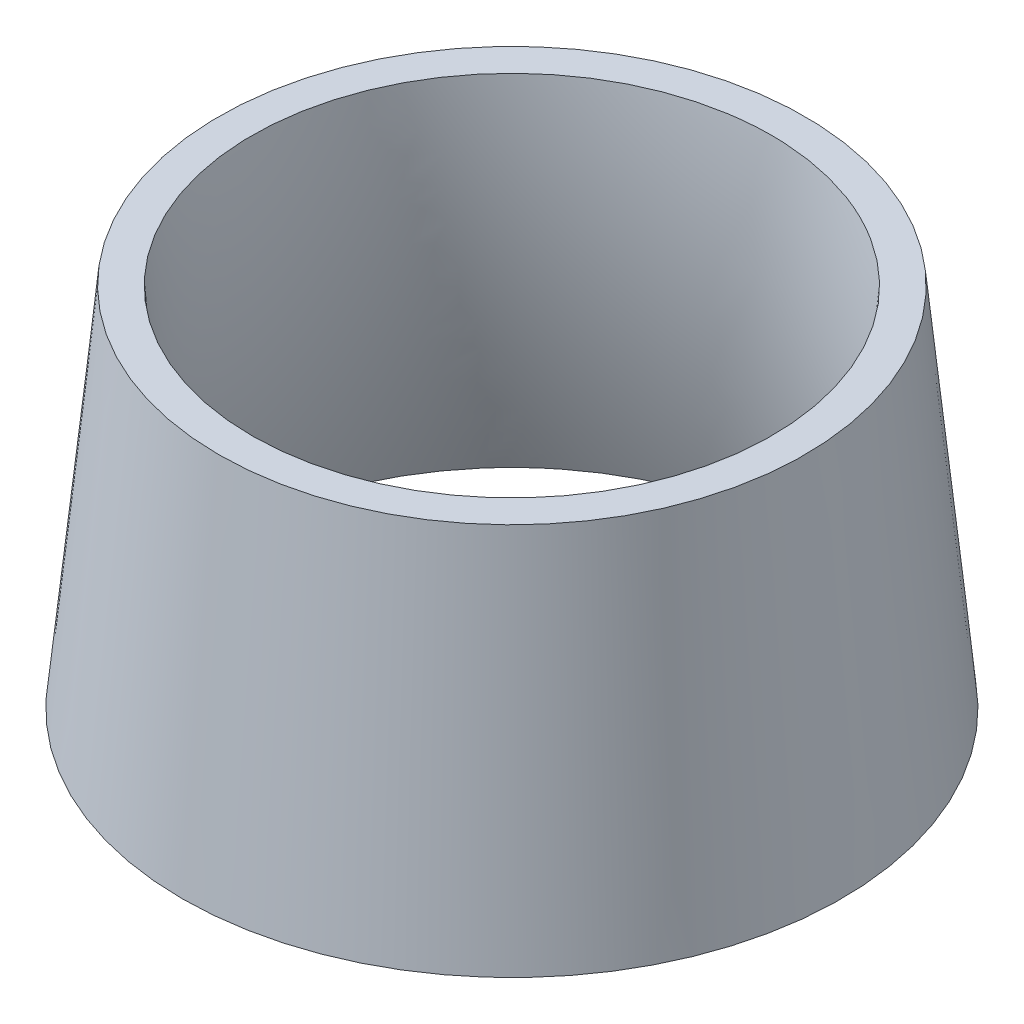
from build123d import *

# Parameters (mm, degrees)
SKETCH2_R = 50.8
SKETCH1_R = 57.15


with BuildPart() as part:
    # Sketch2 → Loft1 section 0
    with BuildSketch(Plane(origin=(0, 63.5, 0), x_dir=(1, 0, 0), z_dir=(0, 1, 0))):
        Circle(SKETCH2_R)
    # Sketch1 → Loft1 section 1
    with BuildSketch(Plane(origin=(0, 0, 0), x_dir=(1, 0, 0), z_dir=(0, 1, 0))):
        Circle(SKETCH1_R)
    loft()

    # Cut-Loft1: read off the stored shape, not the designer's step
    # Cut-Loft1: loft between two sections, ruled curve by curve
    cut_loft1_from = [
        Edge.make_bspline([(-9.059431508, 63.5, 44.165415494), (-97.390262496, 63.5, 26.046552478), (-79.27139948, 63.5, -62.28427851), (9.059431508, 63.5, -44.165415494), (97.390262496, 63.5, -26.046552478), (79.27139948, 63.5, 62.28427851), (-9.059431508, 63.5, 44.165415494)], [0, 0, 0, 0, 0.5, 0.5, 0.5, 1, 1, 1, 1], 3, [1, 0.333333333, 0.333333333, 1, 0.333333333, 0.333333333, 1]),
    ]
    cut_loft1_to = [
        Edge.make_bspline([(25.469723611, 0, 44.393557418), (-63.317391224, 0, 95.333004639), (-114.256838446, 0, 6.545889804), (-25.469723611, 0, -44.393557418), (63.317391224, 0, -95.333004639), (114.256838446, 0, -6.545889804), (25.469723611, 0, 44.393557418)], [0, 0, 0, 0, 0.5, 0.5, 0.5, 1, 1, 1, 1], 3, [1, 0.333333333, 0.333333333, 1, 0.333333333, 0.333333333, 1]),
    ]
    cut_loft1 = Solid(Shell([*[Face.make_surface_from_curves(cut_loft1_from[k], cut_loft1_to[k]) for k in range(1)], Face(Wire(cut_loft1_from)), Face(Wire(cut_loft1_to))]))
    add(cut_loft1, mode=Mode.SUBTRACT)


solid = part.part
